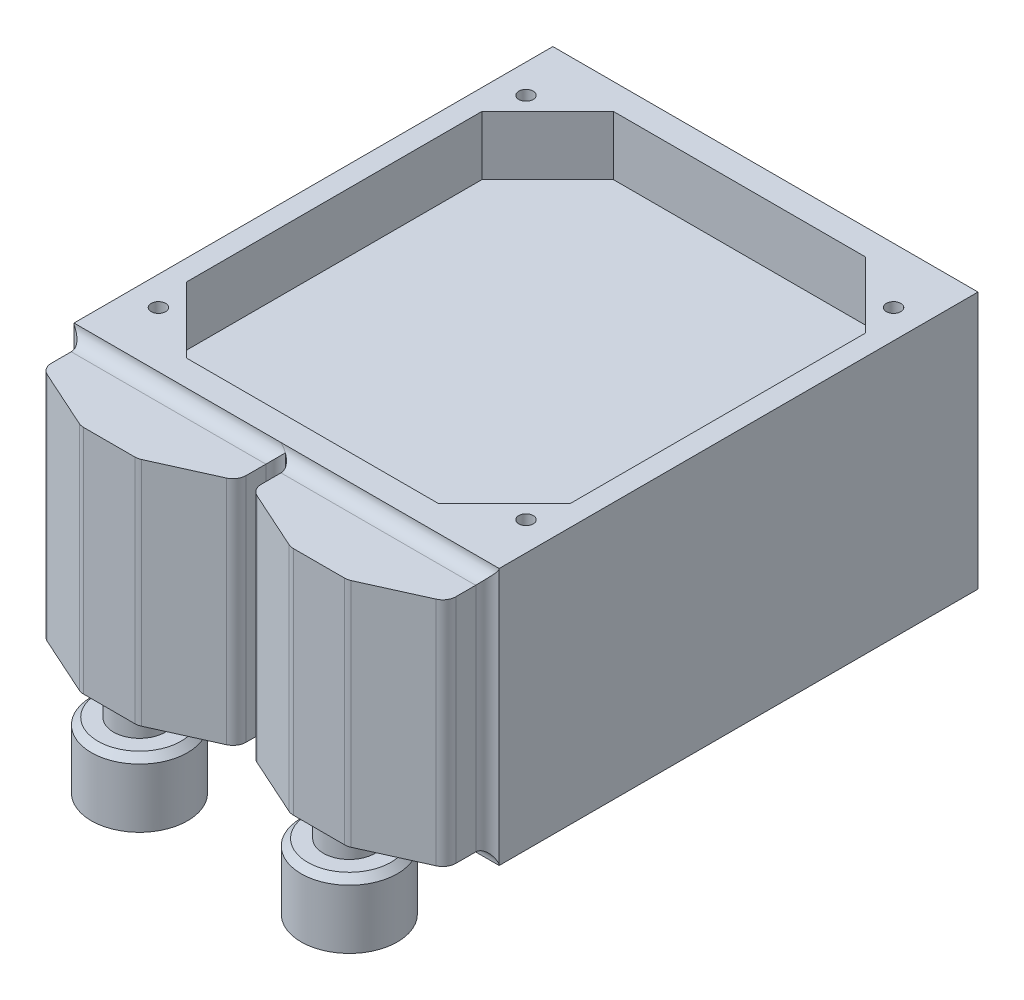
from build123d import *

# Parameters (mm, degrees)
SKETCH1_W           = 82.13
SKETCH1_H           = 92.5
BOSS_EXTRUDE1_DEPTH = 24.85
BOSS_EXTRUDE2_DEPTH = 44.62
FILLET1_R           = 2.54
FILLET3_R           = 2.54
SKETCH4_R           = 5
BOSS_EXTRUDE3_DEPTH = 4.318
SKETCH5_R           = 9.3
BOSS_EXTRUDE4_DEPTH = 12.682
CHAMFER1_SIZE       = 1.27
SKETCH6_R           = 5.5
CUT_EXTRUDE1_DEPTH  = 11.412
SKETCH7_W           = 74.13
SKETCH7_H           = 82.5
CUT_EXTRUDE2_DEPTH  = 11.412
CHAMFER2_SIZE       = 12.7
SKETCH8_R           = 1.4
CUT_EXTRUDE3_DEPTH  = 11.412
MIRROR2_START       = 13.438
MIRROR2_OUTLINE_R   = 1.4
MIRROR2_DEPTH       = 11.412


# Read off the part's stored shape, not the designer's step: Mirror1, Mirror2
with BuildPart() as part:
    # Sketch1 → Boss-Extrude1 (new, symmetric)
    with BuildSketch(Plane(origin=(0, 0, 0), x_dir=(1, 0, 0), z_dir=(0, 1, 0))):
        Rectangle(SKETCH1_W, SKETCH1_H)
    extrude(amount=BOSS_EXTRUDE1_DEPTH, both=True)

    # Sketch2 → Boss-Extrude2 (add)
    with BuildSketch(Plane(origin=(0, 22.31, 0), x_dir=(-1, 0, 0), z_dir=(0, 1, 0))):
        Polygon((-39.065, 46.25), (-39.065, 54.25), (-25.765, 60.25), (-14.765, 60.25), (-1.465, 54.25), (-1.465, 46.25), align=None)
    extrude(amount=-BOSS_EXTRUDE2_DEPTH)

    # Fillet1
    fillet1_edges = [part.edges().sort_by_distance(p)[0] for p in [
        (39.065, 0, 54.25),
        (25.765, 0, 60.25),
        (14.765, 0, 60.25),
        (1.465, 0, 54.25),
    ]]
    fillet(fillet1_edges, radius=FILLET1_R)

    # Fillet3
    # the kernel refuses this fillet: 2.54 mm, written as the material it adds along each edge
    with BuildSketch(Plane(origin=(1.465, 22.31, 46.25), x_dir=(-0.9999999982560405, 0, -5.9058605719345716e-05), z_dir=(0, -1, 0))) as fillet3_piece_1:
        with BuildLine():
            CenterArc((2.539699996, -2.539999996), FILLET3_R, 89.996616191, 90)
            Line((-0.0003, -2.539849987), (-0.0511, -2.539846987))
            ThreePointArc((-0.0511, -2.539846987), (-0.050875, -1.269921998), (-0.0508, 3e-06))
            Line((-0.0508, 3e-06), (3e-06, 0.0508))
            ThreePointArc((3e-06, 0.0508), (1.269927998, 0.050725), (2.539853005, 0.0508))
            Line((2.539853005, 0.0508), (2.539850004, 0))
        make_face()
    extrude(amount=44.62)
    with BuildSketch(Plane(origin=(39.065, 22.31, 46.25), x_dir=(-6.0439665752366e-05, 0, 0.9999999981735235), z_dir=(0, -1, 0))) as fillet3_piece_2:
        with BuildLine():
            CenterArc((2.481660341, -2.539999995), FILLET3_R, 89.996537062, 77.728056522)
            Line((-0.00026745, -1.999968105), (-0.049906006, -1.989167467))
            ThreePointArc((-0.049906006, -1.989167467), (-0.050860439, -0.999980986), (-0.0508, 3.07e-06))
            Line((-0.0508, 3.07e-06), (3.07e-06, 0.0508))
            ThreePointArc((3.07e-06, 0.0508), (1.240909994, 0.050725), (2.481816928, 0.0508))
            Line((2.481816928, 0.0508), (2.481813857, 0))
        make_face()
    extrude(amount=44.62)
    with BuildSketch(Plane(origin=(1.465, 22.31, 46.25), x_dir=(0, -5.9058605719345655e-05, 0.9999999982560405), z_dir=(1, 0, 0)), Plane(origin=(1.465, -22.31, 46.25), x_dir=(0, -0.9999999982560405, -5.905860571934574e-05), z_dir=(1, 0, 0))) as fillet3_piece_3:
        with BuildLine():
            CenterArc((2.539699996, -2.539999996), FILLET3_R, 89.996616191, 90)
            Line((-0.0003, -2.539849987), (-0.0511, -2.539846987))
            ThreePointArc((-0.0511, -2.539846987), (-0.050875, -1.269921998), (-0.0508, 3e-06))
            Line((-0.0508, 3e-06), (3e-06, 0.0508))
            ThreePointArc((3e-06, 0.0508), (1.269927998, 0.050725), (2.539853005, 0.0508))
            Line((2.539853005, 0.0508), (2.539850004, 0))
        make_face()
    extrude(amount=37.6)
    with BuildSketch(Plane(origin=(-4.884625011, 22.31, 46.25), x_dir=(0, -5.9058605719345655e-05, 0.9999999982560405), z_dir=(1, 0, 0))) as fillet3_piece_4a_section:
        with BuildLine():
            CenterArc((2.539699996, -2.539999996), FILLET3_R, 89.996616191, 90)
            Line((-0.0003, -2.539849987), (-0.0511, -2.539846987))
            ThreePointArc((-0.0511, -2.539846987), (-0.050875, -1.269921998), (-0.0508, 3e-06))
            Line((-0.0508, 3e-06), (3e-06, 0.0508))
            ThreePointArc((3e-06, 0.0508), (1.269927998, 0.050725), (2.539853005, 0.0508))
            Line((2.539853005, 0.0508), (2.539850004, 0))
        make_face()
    fillet3_piece_4a = extrude(amount=43.949625011, mode=Mode.PRIVATE)
    fillet3_piece_4a = split(fillet3_piece_4a, bisect_by=Plane(origin=(1.465, 22.885412994, 46.825412994), z_dir=(-1, 0, 0)), keep=Keep.TOP, mode=Mode.PRIVATE)
    with BuildSketch(Plane(origin=(1.465, 28.659625011, 46.25), x_dir=(-0.9999999982560405, 0, -5.9058605719345655e-05), z_dir=(0, -1, 0))) as fillet3_piece_4b_section:
        with BuildLine():
            CenterArc((2.539699996, -2.539999996), FILLET3_R, 89.996616191, 90)
            Line((-0.0003, -2.539849987), (-0.0511, -2.539846987))
            ThreePointArc((-0.0511, -2.539846987), (-0.050875, -1.269921998), (-0.0508, 3e-06))
            Line((-0.0508, 3e-06), (3e-06, 0.0508))
            ThreePointArc((3e-06, 0.0508), (1.269927998, 0.050725), (2.539853005, 0.0508))
            Line((2.539853005, 0.0508), (2.539850004, 0))
        make_face()
    fillet3_piece_4b = extrude(amount=50.969625011, mode=Mode.PRIVATE)
    fillet3_piece_4b = split(fillet3_piece_4b, bisect_by=Plane(origin=(0.889587006, 22.31, 46.825412994), z_dir=(0, 1, 0)), keep=Keep.TOP, mode=Mode.PRIVATE)
    fillet3_piece_4b = split(fillet3_piece_4b, bisect_by=Plane(origin=(0.889587006, 24.85, 46.825412994), z_dir=(0, -1, 0)), keep=Keep.TOP, mode=Mode.PRIVATE)
    fillet3_piece_4 = fillet3_piece_4a & fillet3_piece_4b
    add(fillet3_piece_4)
    with BuildSketch(Plane(origin=(-4.884625011, -22.31, 46.25), x_dir=(0, -0.9999999982560405, -5.905860571934574e-05), z_dir=(1, 0, 0))) as fillet3_piece_5a_section:
        with BuildLine():
            CenterArc((2.539699996, -2.539999996), FILLET3_R, 89.996616191, 90)
            Line((-0.0003, -2.539849987), (-0.0511, -2.539846987))
            ThreePointArc((-0.0511, -2.539846987), (-0.050875, -1.269921998), (-0.0508, 3e-06))
            Line((-0.0508, 3e-06), (3e-06, 0.0508))
            ThreePointArc((3e-06, 0.0508), (1.269927998, 0.050725), (2.539853005, 0.0508))
            Line((2.539853005, 0.0508), (2.539850004, 0))
        make_face()
    fillet3_piece_5a = extrude(amount=43.949625011, mode=Mode.PRIVATE)
    fillet3_piece_5a = split(fillet3_piece_5a, bisect_by=Plane(origin=(1.465, -22.885412994, 46.825412994), z_dir=(-1, 0, 0)), keep=Keep.TOP, mode=Mode.PRIVATE)
    with BuildSketch(Plane(origin=(1.465, 22.31, 46.25), x_dir=(-0.9999999982560405, 0, -5.9058605719345716e-05), z_dir=(0, -1, 0))) as fillet3_piece_5b_section:
        with BuildLine():
            CenterArc((2.539699996, -2.539999996), FILLET3_R, 89.996616191, 90)
            Line((-0.0003, -2.539849987), (-0.0511, -2.539846987))
            ThreePointArc((-0.0511, -2.539846987), (-0.050875, -1.269921998), (-0.0508, 3e-06))
            Line((-0.0508, 3e-06), (3e-06, 0.0508))
            ThreePointArc((3e-06, 0.0508), (1.269927998, 0.050725), (2.539853005, 0.0508))
            Line((2.539853005, 0.0508), (2.539850004, 0))
        make_face()
    fillet3_piece_5b = extrude(amount=50.969625011, mode=Mode.PRIVATE)
    fillet3_piece_5b = split(fillet3_piece_5b, bisect_by=Plane(origin=(0.889587006, -24.85, 46.825412994), z_dir=(0, 1, 0)), keep=Keep.TOP, mode=Mode.PRIVATE)
    fillet3_piece_5b = split(fillet3_piece_5b, bisect_by=Plane(origin=(0.889587006, -22.31, 46.825412994), z_dir=(0, -1, 0)), keep=Keep.TOP, mode=Mode.PRIVATE)
    fillet3_piece_5 = fillet3_piece_5a & fillet3_piece_5b
    add(fillet3_piece_5)
    with BuildSketch(Plane(origin=(39.065, 28.514534643, 46.25), x_dir=(-6.043966575255531e-05, 0, 0.9999999981735235), z_dir=(0, -1, 0))) as fillet3_piece_6a_section:
        with BuildLine():
            CenterArc((2.481660341, -2.539999995), FILLET3_R, 89.996537062, 77.728056522)
            Line((-0.00026745, -1.999968105), (-0.049906006, -1.989167467))
            ThreePointArc((-0.049906006, -1.989167467), (-0.050860439, -0.999980986), (-0.0508, 3.07e-06))
            Line((-0.0508, 3.07e-06), (3.07e-06, 0.0508))
            ThreePointArc((3.07e-06, 0.0508), (1.240909994, 0.050725), (2.481816928, 0.0508))
            Line((2.481816928, 0.0508), (2.481813857, 0))
        make_face()
    fillet3_piece_6a = extrude(amount=50.824534643, mode=Mode.PRIVATE)
    fillet3_piece_6a = split(fillet3_piece_6a, bisect_by=Plane(origin=(39.565672123, 22.31, 46.830384654), z_dir=(0, 1, 0)), keep=Keep.TOP, mode=Mode.PRIVATE)
    fillet3_piece_6a = split(fillet3_piece_6a, bisect_by=Plane(origin=(39.565672123, 24.85, 46.830384654), z_dir=(0, -1, 0)), keep=Keep.TOP, mode=Mode.PRIVATE)
    with BuildSketch(Plane(origin=(1.465, 22.31, 46.25), x_dir=(0, -5.9058605719345655e-05, 0.9999999982560405), z_dir=(1, 0, 0))) as fillet3_piece_6b_section:
        with BuildLine():
            CenterArc((2.539699996, -2.539999996), FILLET3_R, 89.996616191, 90)
            Line((-0.0003, -2.539849987), (-0.0511, -2.539846987))
            ThreePointArc((-0.0511, -2.539846987), (-0.050875, -1.269921998), (-0.0508, 3e-06))
            Line((-0.0508, 3e-06), (3e-06, 0.0508))
            ThreePointArc((3e-06, 0.0508), (1.269927998, 0.050725), (2.539853005, 0.0508))
            Line((2.539853005, 0.0508), (2.539850004, 0))
        make_face()
    fillet3_piece_6b = extrude(amount=43.949625011, mode=Mode.PRIVATE)
    fillet3_piece_6b = split(fillet3_piece_6b, bisect_by=Plane(origin=(39.065, 22.885412994, 46.825412994), z_dir=(1, 0, 0)), keep=Keep.TOP, mode=Mode.PRIVATE)
    fillet3_piece_6b = split(fillet3_piece_6b, bisect_by=Plane(origin=(41.065, 22.885412994, 46.825412994), z_dir=(-1, 0, 0)), keep=Keep.TOP, mode=Mode.PRIVATE)
    fillet3_piece_6 = fillet3_piece_6a & fillet3_piece_6b
    add(fillet3_piece_6)
    with BuildSketch(Plane(origin=(39.065, 22.31, 46.25), x_dir=(-6.0439665752366e-05, 0, 0.9999999981735235), z_dir=(0, -1, 0))) as fillet3_piece_7a_section:
        with BuildLine():
            CenterArc((2.481660341, -2.539999995), FILLET3_R, 89.996537062, 77.728056522)
            Line((-0.00026745, -1.999968105), (-0.049906006, -1.989167467))
            ThreePointArc((-0.049906006, -1.989167467), (-0.050860439, -0.999980986), (-0.0508, 3.07e-06))
            Line((-0.0508, 3.07e-06), (3.07e-06, 0.0508))
            ThreePointArc((3.07e-06, 0.0508), (1.240909994, 0.050725), (2.481816928, 0.0508))
            Line((2.481816928, 0.0508), (2.481813857, 0))
        make_face()
    fillet3_piece_7a = extrude(amount=50.824534643, mode=Mode.PRIVATE)
    fillet3_piece_7a = split(fillet3_piece_7a, bisect_by=Plane(origin=(39.565672123, -22.31, 46.830384654), z_dir=(0, -1, 0)), keep=Keep.TOP, mode=Mode.PRIVATE)
    fillet3_piece_7a = split(fillet3_piece_7a, bisect_by=Plane(origin=(39.565672123, -24.85, 46.830384654), z_dir=(0, 1, 0)), keep=Keep.TOP, mode=Mode.PRIVATE)
    with BuildSketch(Plane(origin=(1.465, -22.31, 46.25), x_dir=(0, -0.9999999982560405, -5.905860571934574e-05), z_dir=(1, 0, 0))) as fillet3_piece_7b_section:
        with BuildLine():
            CenterArc((2.539699996, -2.539999996), FILLET3_R, 89.996616191, 90)
            Line((-0.0003, -2.539849987), (-0.0511, -2.539846987))
            ThreePointArc((-0.0511, -2.539846987), (-0.050875, -1.269921998), (-0.0508, 3e-06))
            Line((-0.0508, 3e-06), (3e-06, 0.0508))
            ThreePointArc((3e-06, 0.0508), (1.269927998, 0.050725), (2.539853005, 0.0508))
            Line((2.539853005, 0.0508), (2.539850004, 0))
        make_face()
    fillet3_piece_7b = extrude(amount=43.949625011, mode=Mode.PRIVATE)
    fillet3_piece_7b = split(fillet3_piece_7b, bisect_by=Plane(origin=(39.065, -22.885412994, 46.825412994), z_dir=(1, 0, 0)), keep=Keep.TOP, mode=Mode.PRIVATE)
    fillet3_piece_7b = split(fillet3_piece_7b, bisect_by=Plane(origin=(41.065, -22.885412994, 46.825412994), z_dir=(-1, 0, 0)), keep=Keep.TOP, mode=Mode.PRIVATE)
    fillet3_piece_7 = fillet3_piece_7a & fillet3_piece_7b
    add(fillet3_piece_7)

    # Sketch4 → Boss-Extrude3 (add)
    with BuildSketch(Plane.XZ.offset(22.31)):
        with Locations(Location((20.265, 54.402968129, 0), (0, 0, 90))):
            Circle(SKETCH4_R)
    extrude(amount=BOSS_EXTRUDE3_DEPTH)

    # Sketch5 → Boss-Extrude4 (add)
    with BuildSketch(Plane.XZ.offset(26.628)):
        with Locations(Location((20.265, 54.402968129, 0), (0, 0, 90))):
            Circle(SKETCH5_R)
    extrude(amount=BOSS_EXTRUDE4_DEPTH)

    # Chamfer1
    chamfer1_edges = [part.edges().sort_by_distance(p)[0] for p in [
        (20.265, -26.628, 45.102968129),
    ]]
    chamfer(chamfer1_edges, length=CHAMFER1_SIZE)

    # Sketch6 → Cut-Extrude1 (cut)
    with BuildSketch(Plane.XZ.offset(39.31)):
        with Locations(Location((20.265, 54.402968129, 0), (0, 0, 270))):
            Circle(SKETCH6_R)
    extrude(amount=-CUT_EXTRUDE1_DEPTH, mode=Mode.SUBTRACT)

    # Mirror1: part across plane


with BuildPart() as part_1:
    add(part.part)
    add(part.part.mirror(Plane(origin=(0, 0, 0), x_dir=(0, 0, 1), z_dir=(1, 0, 0))))

    # Sketch7 → Cut-Extrude2 (cut)
    with BuildSketch(Plane.XZ.offset(24.85)):
        Rectangle(SKETCH7_W, SKETCH7_H)
    extrude(amount=-CUT_EXTRUDE2_DEPTH, mode=Mode.SUBTRACT)

    # Chamfer2
    chamfer2_edges = [part_1.edges().sort_by_distance(p)[0] for p in [
        (-37.065, -19.144, -41.25),
        (-37.065, -19.144, 41.25),
        (37.065, -19.144, 41.25),
        (37.065, -19.144, -41.25),
    ]]
    chamfer(chamfer2_edges, length=CHAMFER2_SIZE)

    # Sketch8 → Cut-Extrude3 (cut)
    with BuildSketch(Plane.XZ.offset(24.85)):
        with Locations(Location((-35.5, 35.5, 0), (0, 0, 270))):
            Circle(SKETCH8_R)
        with Locations(Location((35.5, 35.5, 0), (0, 0, 270))):
            Circle(SKETCH8_R)
        with Locations(Location((35.5, -35.5, 0), (0, 0, 270))):
            Circle(SKETCH8_R)
        with Locations(Location((-35.5, -35.5, 0), (0, 0, 270))):
            Circle(SKETCH8_R)
    extrude(amount=-CUT_EXTRUDE3_DEPTH, mode=Mode.SUBTRACT)

    # Mirror2 outline → Mirror2 (cut)
    with BuildSketch(Plane(origin=(0, 0, 0), x_dir=(1, 0, 0), z_dir=(0, 1, 0)).offset(MIRROR2_START)):
        Polygon((-24.365, 41.25), (-37.065, 28.55), (-37.065, -28.55), (-24.365, -41.25), (24.365, -41.25), (37.065, -28.55), (37.065, 28.55), (24.365, 41.25), align=None)
        with Locations((-35.5, -35.5)):
            Circle(MIRROR2_OUTLINE_R)
        with Locations((35.5, -35.5)):
            Circle(MIRROR2_OUTLINE_R)
        with Locations((35.5, 35.5)):
            Circle(MIRROR2_OUTLINE_R)
        with Locations((-35.5, 35.5)):
            Circle(MIRROR2_OUTLINE_R)
    extrude(amount=MIRROR2_DEPTH, mode=Mode.SUBTRACT)


solid = part_1.part
